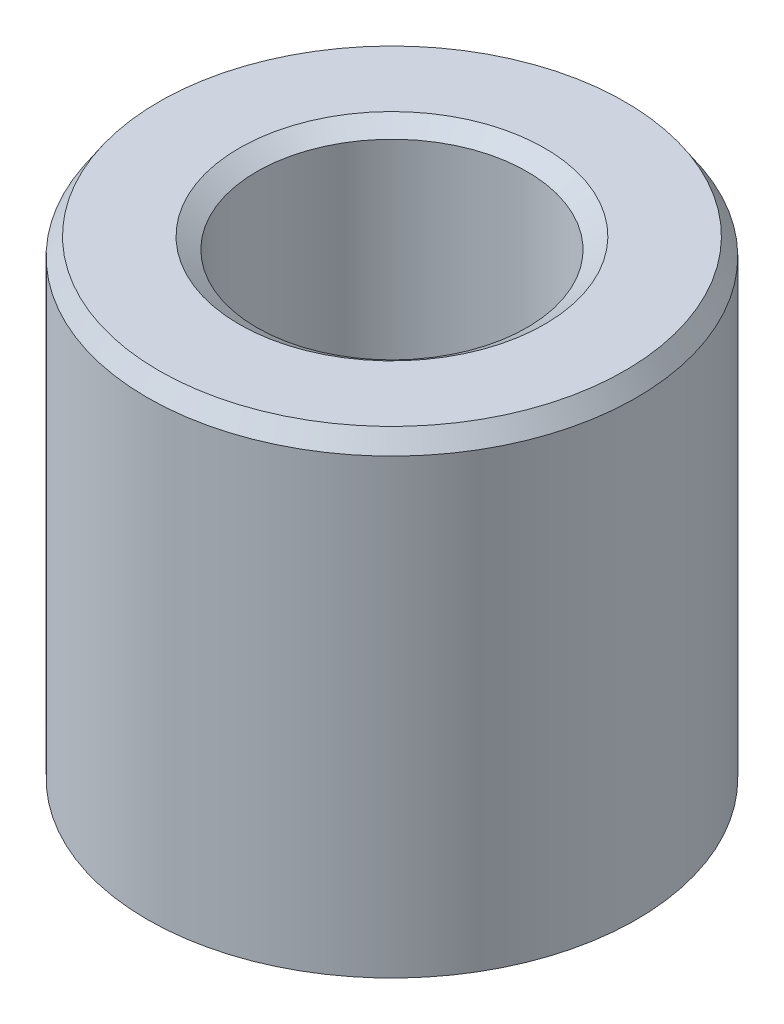
from build123d import *
from OCP.BRepFilletAPI import BRepFilletAPI_MakeChamfer

# Parameters (mm, degrees)
SKETCH1_R           = 45
BOSS_EXTRUDE1_DEPTH = 88.531924598
SKETCH2_R           = 24.869668514
CUT_EXTRUDE1_DEPTH  = 110.031654454
CHAMFER1_SIZE       = 3.228280455
CHAMFER1_SIZE2      = 2.13009298


with BuildPart() as part:
    # Sketch1 → Boss-Extrude1 (new body)
    with BuildSketch(Plane(origin=(0, 0, 0), x_dir=(1, 0, 0), z_dir=(0, 1, 0))):
        Circle(SKETCH1_R)
    extrude(amount=BOSS_EXTRUDE1_DEPTH)

    # Sketch2 → Cut-Extrude1 (cut, through all)
    with BuildSketch(Plane(origin=(0, 0, 0), x_dir=(1, 0, 0), z_dir=(0, 1, 0))):
        Circle(SKETCH2_R)
    extrude(amount=CUT_EXTRUDE1_DEPTH, mode=Mode.SUBTRACT)

    # Chamfer1: one chamfer whose edges measure the first distance from different faces: ONE call of the kernel's chamfer builder (chamfer() names one face for all edges)
    chamfer1_edges_1 = [part.edges().sort_by_distance(p)[0] for p in [
        (-24.869668514, 88.531924598, 0),
    ]]
    chamfer1_side_1 = [part.faces().sort_by_distance(p)[0] for p in [
        (-43.727207794, 88.531924598, 0),
    ]]
    chamfer1_edges_2 = [part.edges().sort_by_distance(p)[0] for p in [
        (-24.869668514, 0, 0),
    ]]
    chamfer1_side_2 = [part.faces().sort_by_distance(p)[0] for p in [
        (-24.869668514, 44.265962299, 0),
    ]]
    chamfer1_edges_3 = [part.edges().sort_by_distance(p)[0] for p in [
        (-45, 0, 0),
    ]]
    chamfer1_side_3 = [part.faces().sort_by_distance(p)[0] for p in [
        (-43.727207794, 0, 0),
    ]]
    chamfer1_edges_4 = [part.edges().sort_by_distance(p)[0] for p in [
        (-45, 88.531924598, 0),
    ]]
    chamfer1_side_4 = [part.faces().sort_by_distance(p)[0] for p in [
        (-45, 44.265962299, 0),
    ]]
    chamfer1 = BRepFilletAPI_MakeChamfer(part.part.solid().wrapped)
    for e in chamfer1_edges_1:
        chamfer1.Add(CHAMFER1_SIZE, CHAMFER1_SIZE2, e.wrapped, chamfer1_side_1[0].wrapped)  # the first distance lies on this face
    for e in chamfer1_edges_2:
        chamfer1.Add(CHAMFER1_SIZE, CHAMFER1_SIZE2, e.wrapped, chamfer1_side_2[0].wrapped)  # the first distance lies on this face
    for e in chamfer1_edges_3:
        chamfer1.Add(CHAMFER1_SIZE, CHAMFER1_SIZE2, e.wrapped, chamfer1_side_3[0].wrapped)  # the first distance lies on this face
    for e in chamfer1_edges_4:
        chamfer1.Add(CHAMFER1_SIZE, CHAMFER1_SIZE2, e.wrapped, chamfer1_side_4[0].wrapped)  # the first distance lies on this face
    add(Compound.cast(chamfer1.Shape()), mode=Mode.REPLACE)


solid = part.part
